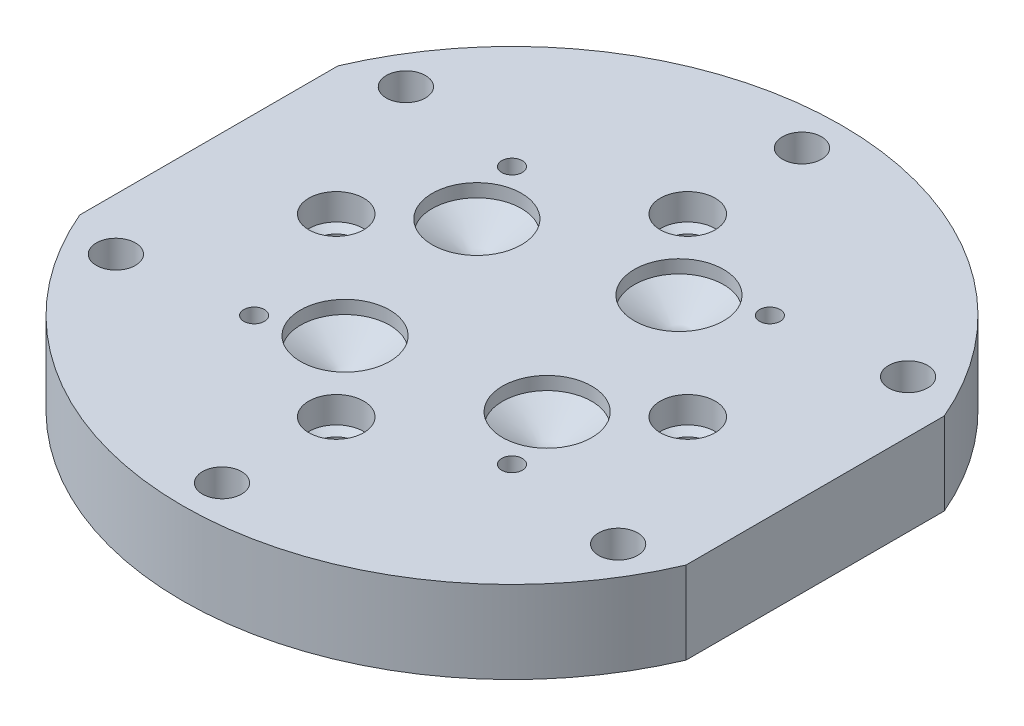
from build123d import *

# Parameters (mm, degrees)
OUTER_R                     = 19.05
BODY_DEPTH                  = 4.7625
F_4_40_TAPPED_HOLE_D        = 2.2606
SCREW_HOLES_COUNT           = 6
F_0_80_TAPPED_HOLE_D        = 1.19126
INNER_SCREW_HOLES_COUNT     = 4
F_43_0_089_DIAMETER_HOLE1_D = 2.2606
IO_HOLES_PATTERN_COUNT      = 4
POST_BOTTOMS_COUNT          = 4
FLAT_CUT_DEPTH              = 28.358479604
FLAT_CUT_DEPTH_BACK         = 28.358479604
FLAT_CUT_SKETCH_W           = 3.048
FLAT_CUT_SKETCH_H           = 38.1


with BuildPart() as part:
    # outer → Body (new body)
    with BuildSketch(Plane(origin=(0, 0, 0), x_dir=(1, 0, 0), z_dir=(0, 1, 0))):
        Circle(OUTER_R)
    extrude(amount=-BODY_DEPTH)

    # #4-40 Tapped Hole (through all)
    with Locations(Plane(origin=(0, 0, 0), x_dir=(1, 0, 0), z_dir=(0, 1, 0))):
        with Locations((0, -16.764)):
            f_4_40_tapped_hole = Hole(F_4_40_TAPPED_HOLE_D / 2)

    # Screw Holes: #4-40 Tapped Hole ×6 about axis
    screw_holes_axis = Axis((0, 0.15875, 0), (0, -1, 0))
    for i in range(1, SCREW_HOLES_COUNT):
        add(f_4_40_tapped_hole.rotate(screw_holes_axis, i * 360 / SCREW_HOLES_COUNT), mode=Mode.SUBTRACT)

    # #0-80 Tapped Hole (through all)
    with Locations(Plane(origin=(0, 0, 0), x_dir=(1, 0, 0), z_dir=(0, 1, 0))):
        with Locations((-7.45361258, 7.45361258)):
            f_0_80_tapped_hole = Hole(F_0_80_TAPPED_HOLE_D / 2)

    # Inner Screw Holes: #0-80 Tapped Hole ×4 about axis
    inner_screw_holes_axis = Axis((0, 0.15875, 0), (0, -1, 0))
    for i in range(1, INNER_SCREW_HOLES_COUNT):
        add(f_0_80_tapped_hole.rotate(inner_screw_holes_axis, i * 360 / INNER_SCREW_HOLES_COUNT), mode=Mode.SUBTRACT)

    # #43 (0.089) Diameter Hole1 (through all)
    with Locations(Plane(origin=(0, 0, 0), x_dir=(1, 0, 0), z_dir=(0, 1, 0))):
        with Locations((0, 10.16)):
            f_43_0_089_diameter_hole1 = Hole(F_43_0_089_DIAMETER_HOLE1_D / 2)

    # Sketch40 → 1/8 (0.125) Diameter Hole1 (revolve, cut)
    with BuildSketch(Plane(origin=(0, 0, -10.16), x_dir=(0, 0, 1), z_dir=(1, 0, 0))):
        Polygon((0, 0), (0, 2.477866233), (1.5875, 1.524), (1.5875, 0), align=None)
    f_1_8_0_125_diameter_hole1 = revolve(axis=Axis((0, 6.35, -10.16), (0, -1, 0)), mode=Mode.SUBTRACT)

    # Sketch42 → 1/8 (0.125) Diameter Hole2 (revolve, cut)
    with BuildSketch(Plane(origin=(0, -4.7625, -10.16), x_dir=(0, 0, -1), z_dir=(1, 0, 0))):
        Polygon((0, 0), (0, 2.477866233), (1.5875, 1.524), (1.5875, 0), align=None)
    f_1_8_0_125_diameter_hole2 = revolve(axis=Axis((0, -11.1125, -10.16), (0, 1, 0)), mode=Mode.SUBTRACT)

    # IO Holes Pattern: #43 (0.089) Diameter Hole1, 1/8 (0.125) Diameter Hole1, 1/8 (0.125) Diameter Hole2 ×4 about axis
    io_holes_pattern_axis = Axis((0, 0.15875, 0), (0, -1, 0))
    add([f_43_0_089_diameter_hole1.rotate(io_holes_pattern_axis, i * 360 / IO_HOLES_PATTERN_COUNT) for i in range(1, IO_HOLES_PATTERN_COUNT)], mode=Mode.SUBTRACT)
    add([f_1_8_0_125_diameter_hole1.rotate(io_holes_pattern_axis, i * 360 / IO_HOLES_PATTERN_COUNT) for i in range(1, IO_HOLES_PATTERN_COUNT)], mode=Mode.SUBTRACT)
    add([f_1_8_0_125_diameter_hole2.rotate(io_holes_pattern_axis, i * 360 / IO_HOLES_PATTERN_COUNT) for i in range(1, IO_HOLES_PATTERN_COUNT)], mode=Mode.SUBTRACT)

    # Sketch45 → 13/64 (0.20313) Diameter Hole1 (revolve, cut)
    with BuildSketch(Plane(origin=(3.81, 0, -5.842), x_dir=(0, 0, 1), z_dir=(1, 0, 0))):
        Polygon((0, 0), (0, 2.312070783), (2.579751, 0.762), (2.579751, 0), align=None)
    f_13_64_0_20313_diameter_hole1 = revolve(axis=Axis((3.81, 6.35, -5.842), (0, -1, 0)), mode=Mode.SUBTRACT)

    # Post Bottoms: 13/64 (0.20313) Diameter Hole1 ×4 about axis
    post_bottoms_axis = Axis((0, 0.15875, 0), (0, -1, 0))
    for i in range(1, POST_BOTTOMS_COUNT):
        add(f_13_64_0_20313_diameter_hole1.rotate(post_bottoms_axis, i * 360 / POST_BOTTOMS_COUNT), mode=Mode.SUBTRACT)

    # Flat Cut Sketch → Flat Cut (cut, two sides: drawn at the far end of the back side and taken through both)
    with BuildSketch(Plane(origin=(0, 0, 0), x_dir=(1, 0, 0), z_dir=(0, 1, 0)).offset(-FLAT_CUT_DEPTH_BACK)):
        with Locations((-19.05, 0)):
            Rectangle(FLAT_CUT_SKETCH_W, FLAT_CUT_SKETCH_H)
        with Locations((19.05, 0)):
            Rectangle(FLAT_CUT_SKETCH_W, FLAT_CUT_SKETCH_H)
    extrude(amount=FLAT_CUT_DEPTH + FLAT_CUT_DEPTH_BACK, mode=Mode.SUBTRACT)


solid = part.part
